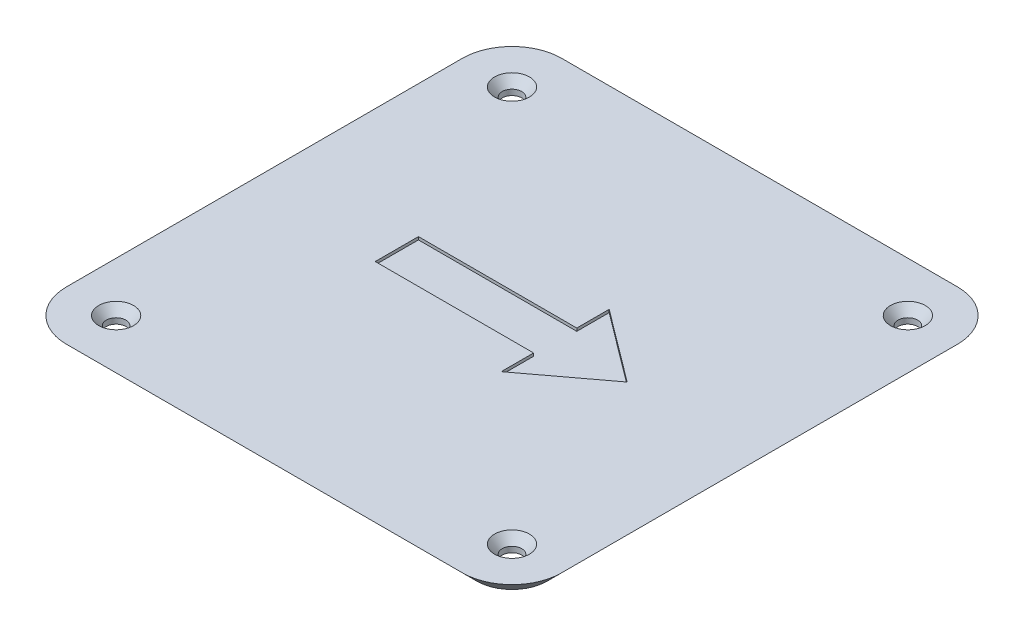
from build123d import *

# Parameters (mm, degrees)
BOSS_EXTRUDE1_DEPTH                           = 2.54
CHAMFER1_SIZE                                 = 2.54
CSK_FOR_4_FLAT_HEAD_MACHINE_SCREW1_AT_2_COUNT = 2
CSK_FOR_4_FLAT_HEAD_MACHINE_SCREW1_AT_2_PITCH = 69.85
CSK_FOR_4_FLAT_HEAD_MACHINE_SCREW1_AT_3_COUNT = 2
CSK_FOR_4_FLAT_HEAD_MACHINE_SCREW1_AT_3_PITCH = 69.85
CSK_FOR_4_FLAT_HEAD_MACHINE_SCREW1_AT_4_COUNT = 2
CSK_FOR_4_FLAT_HEAD_MACHINE_SCREW1_AT_4_PITCH = 98.782817332
CUT_EXTRUDE2_DEPTH                            = 0.508


with BuildPart() as part:
    # Sketch1 → Boss-Extrude1 (new body)
    with BuildSketch(Plane(origin=(0, 0, 0), x_dir=(1, 0, 0), z_dir=(0, 1, 0))):
        with BuildLine():
            Line((-43.688, 34.925), (-43.688, -34.925))
            ThreePointArc((-43.688, -34.925), (-41.121376724, -41.121376724), (-34.925, -43.688))
            Line((-34.925, -43.688), (34.925, -43.688))
            ThreePointArc((34.925, -43.688), (41.121376724, -41.121376724), (43.688, -34.925))
            Line((43.688, -34.925), (43.688, 34.925))
            ThreePointArc((43.688, 34.925), (41.121376724, 41.121376724), (34.925, 43.688))
            Line((34.925, 43.688), (-34.925, 43.688))
            ThreePointArc((-34.925, 43.688), (-41.121376724, 41.121376724), (-43.688, 34.925))
        make_face()
    extrude(amount=BOSS_EXTRUDE1_DEPTH)

    # Chamfer1
    chamfer1_edges = [part.edges().sort_by_distance(p)[0] for p in [
        (-43.688, 0, 0),
        (-41.121376724, 0, 41.121376724),
        (-41.121376724, 0, -41.121376724),
        (0, 0, 43.688),
        (0, 0, -43.688),
        (41.121376724, 0, 41.121376724),
        (41.121376724, 0, -41.121376724),
        (43.688, 0, 0),
    ]]
    chamfer(chamfer1_edges, length=CHAMFER1_SIZE - 0.0001)  # a hair under: the kernel refuses the full size

    # Sketch6 → CSK for #4 Flat Head Machine Screw1 (revolve, cut)
    with BuildSketch(Plane(origin=(-34.925, 2.54, -34.925), x_dir=(0, 0, 1), z_dir=(1, 0, 0))):
        Polygon((0, 0), (0, 2.54), (1.7272, 2.54), (1.7272, 1.554265286), (3.0783022, 0), align=None)
    csk_for_4_flat_head_machine_screw1 = revolve(axis=Axis((-34.925, 8.89, -34.925), (0, -1, 0)), mode=Mode.SUBTRACT)

    # CSK for #4 Flat Head Machine Screw1 at 2: CSK for #4 Flat Head Machine Screw1 ×2
    with Locations(*[(i * CSK_FOR_4_FLAT_HEAD_MACHINE_SCREW1_AT_2_PITCH, 0, 0) for i in range(1, CSK_FOR_4_FLAT_HEAD_MACHINE_SCREW1_AT_2_COUNT)]):
        add(csk_for_4_flat_head_machine_screw1, mode=Mode.SUBTRACT)

    # CSK for #4 Flat Head Machine Screw1 at 3: CSK for #4 Flat Head Machine Screw1 ×2
    with Locations(*[(0, 0, i * CSK_FOR_4_FLAT_HEAD_MACHINE_SCREW1_AT_3_PITCH) for i in range(1, CSK_FOR_4_FLAT_HEAD_MACHINE_SCREW1_AT_3_COUNT)]):
        add(csk_for_4_flat_head_machine_screw1, mode=Mode.SUBTRACT)

    # CSK for #4 Flat Head Machine Screw1 at 4: CSK for #4 Flat Head Machine Screw1 ×2
    with Locations(*[Vector(0.7071067811865477, 0, 0.7071067811865475) * (i * CSK_FOR_4_FLAT_HEAD_MACHINE_SCREW1_AT_4_PITCH) for i in range(1, CSK_FOR_4_FLAT_HEAD_MACHINE_SCREW1_AT_4_COUNT)]):
        add(csk_for_4_flat_head_machine_screw1, mode=Mode.SUBTRACT)

    # Sketch3 → Cut-Extrude2 (cut)
    with BuildSketch(Plane(origin=(0, 2.54, 0), x_dir=(1, 0, 0), z_dir=(0, 1, 0))):
        Polygon((0, 3.81), (7.62, 3.81), (7.62, 9.525), (20.32, 0), (7.62, -9.525), (7.62, -3.81), (0, -3.81), (-20.32, -3.81), (-20.32, 3.81), align=None)
    extrude(amount=-CUT_EXTRUDE2_DEPTH, mode=Mode.SUBTRACT)


solid = part.part
